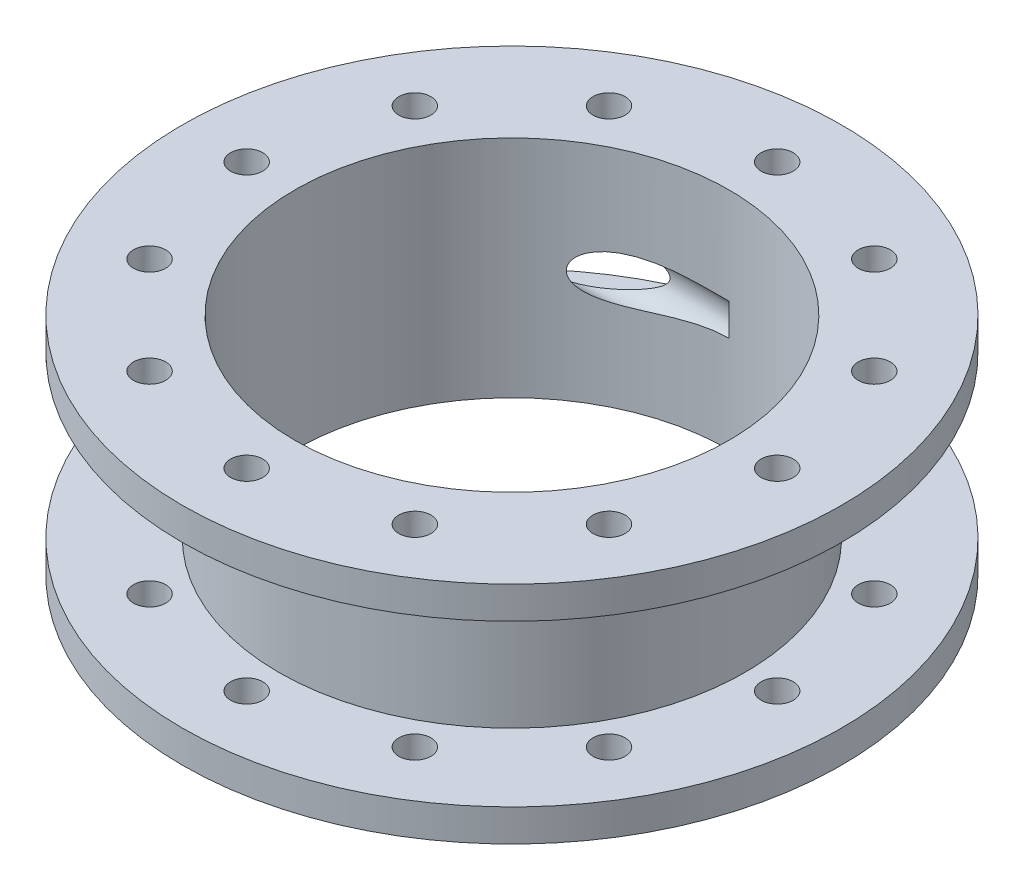
from build123d import *

# Parameters (mm, degrees)
SKETCH1_R            = 65.08749999999999
SKETCH1_R_2          = 3.1749999999997374
SKETCH1_R_3          = 3.174999999999826
SKETCH1_R_4          = 3.1749999999999874
SKETCH1_R_5          = 3.1749999999998075
SKETCH1_R_6          = 3.1749999999998435
SKETCH1_R_7          = 3.174999999999926
SKETCH1_R_8          = 3.1750000000000713
SKETCH1_R_9          = 3.1750000000002263
SKETCH1_R_10         = 3.1749999999999767
SKETCH1_R_11         = 3.175000000000085
SKETCH1_R_12         = 3.175000000000142
BOSS_EXTRUDE1_DEPTH  = 6.35
BOSS_EXTRUDE7_DEPTH  = 6.35
MOVE_FACE6_BY        = 6.35
MOVE_FACE6_2_BY      = 6.35
MOVE_FACE6_3_BY      = 6.35
BOSS_EXTRUDE8_START  = 44.449999999999996
BOSS_EXTRUDE8_DEPTH  = 44.449999999999996
BOSS_EXTRUDE10_START = 6.35
SKETCH1_13_R         = 65.08749999999999
SKETCH1_13_R_2       = 3.1749999999997374
SKETCH1_13_R_3       = 3.174999999999826
SKETCH1_13_R_4       = 3.1749999999999874
SKETCH1_13_R_5       = 3.1749999999998075
SKETCH1_13_R_6       = 3.1749999999998435
SKETCH1_13_R_7       = 3.174999999999926
SKETCH1_13_R_8       = 3.1750000000000713
SKETCH1_13_R_9       = 3.1750000000002263
SKETCH1_13_R_10      = 3.1749999999999767
SKETCH1_13_R_11      = 3.175000000000085
SKETCH1_13_R_12      = 3.175000000000142
BOSS_EXTRUDE10_DEPTH = 6.35
SKETCH2_R            = 4.49012806053458
CUT_EXTRUDE1_DEPTH   = 38.1


with BuildPart() as part:
    # Sketch1 → Boss-Extrude1 (new body)
    # profile 1 of 2: a face of its own
    with BuildSketch(Plane(origin=(0, 0, 0), x_dir=(1, 0, 0), z_dir=(0, 1, 0))):
        with Locations(Location((0, 0, 0), (0, 0, 270))):
            Circle(SKETCH1_R)
        with Locations(Location((-26.193749999999444, -45.36890584075757, 0), (0, 0, 270))):
            Circle(SKETCH1_R_2, mode=Mode.SUBTRACT)
        with Locations(Location((-45.36890584075695, -26.193750000000517, 0), (0, 0, 270))):
            Circle(SKETCH1_R_3, mode=Mode.SUBTRACT)
        with Locations(Location((-52.38749999999999, -5.8287e-13, 0), (0, 0, 270))):
            Circle(SKETCH1_R_4, mode=Mode.SUBTRACT)
        with Locations(Location((5.8437e-13, -52.38749999999999, 0), (0, 0, 270))):
            Circle(SKETCH1_R_5, mode=Mode.SUBTRACT)
        with Locations(Location((26.193750000000502, -45.368905840756966, 0), (0, 0, 270))):
            Circle(SKETCH1_R_6, mode=Mode.SUBTRACT)
        with Locations(Location((45.36890584075758, -26.193749999999447, 0), (0, 0, 270))):
            Circle(SKETCH1_R_7, mode=Mode.SUBTRACT)
        with Locations(Location((-45.36890584075756, 26.193749999999472, 0), (0, 0, 270))):
            Circle(SKETCH1_R_8, mode=Mode.SUBTRACT)
        with Locations(Location((-6.0368e-13, 52.38750000000001, 0), (0, 0, 270))):
            Circle(SKETCH1_R_9, mode=Mode.SUBTRACT)
        with BuildLine():
            Line((-24.244761862165653, 42.86249999999999), (-16.800520825261128, 42.8625))
            ThreePointArc((-16.80052082526106, 42.86249999999964), (25.94221876360081, 38.03225856916045), (46.0375, 0))
            ThreePointArc((46.0375, -1.128e-14), (-20.353392839950203, -41.29395604870844), (-28.040840750590878, 36.51250000000003))
            Line((-28.040840750590878, 36.51249999999999), (-38.10000000000001, 36.51249999999999))
            Line((-38.10000000000001, 36.51249999999999), (-38.10000000000001, 42.86249999999999))
            Line((-38.10000000000001, 42.86249999999999), (-28.142738137835213, 42.86249999999999))
            ThreePointArc((-28.142738137835213, 42.86249999999998), (-27.588846351937473, 48.2209807291169), (-23.01875000000034, 45.36890584075697))
            ThreePointArc((-23.01875000000034, 45.36890584075697), (-23.341675111640548, 43.973809488820095), (-24.24476186216568, 42.86250000000009))
        make_face(mode=Mode.SUBTRACT)
        with Locations(Location((52.38749999999997, 5.8711e-13, 0), (0, 0, 270))):
            Circle(SKETCH1_R_10, mode=Mode.SUBTRACT)
        with Locations(Location((45.36890584075695, 26.19375000000053, 0), (0, 0, 270))):
            Circle(SKETCH1_R_11, mode=Mode.SUBTRACT)
        with Locations(Location((26.19374999999944, 45.36890584075759, 0), (0, 0, 270))):
            Circle(SKETCH1_R_12, mode=Mode.SUBTRACT)
    # profile 2 of 2: a face of its own
    with BuildSketch(Plane(origin=(0, 0, 0), x_dir=(1, 0, 0), z_dir=(0, 1, 0))):
        with BuildLine():
            ThreePointArc((-28.040840750590878, 36.51250000000003), (-22.644371309313744, 40.08346110624591), (-16.80052082526106, 42.86249999999964))
            Line((-16.800520825261128, 42.8625), (-24.244761862165653, 42.86249999999999))
            ThreePointArc((-24.24476186216568, 42.86250000000009), (-26.19375000000043, 42.1939058407568), (-28.142738137835213, 42.86249999999998))
            Line((-28.142738137835213, 42.86249999999999), (-38.10000000000001, 42.86249999999999))
            Line((-38.10000000000001, 42.86249999999999), (-38.10000000000001, 36.51249999999999))
            Line((-38.10000000000001, 36.51249999999999), (-28.040840750590878, 36.51249999999999))
        make_face()
    extrude(amount=BOSS_EXTRUDE1_DEPTH)


with BuildPart() as part_1:
    # Move Face4: read off the stored shape, not the designer's step
    # Move Face4: moved
    add(part.part.moved(Location((0, 44.45, 0))))

    # Move Face6: a face moved outward by 6.35
    extrude(part_1.faces().sort_by_distance((-32.54375, 44.45, 52.07))[0], amount=MOVE_FACE6_BY, dir=(0, -1, 0))

    # Move Face6 2: a curved face moved outward by 6.35
    add(Solid.thicken(part_1.faces().sort_by_distance((0, 47.625, -65.0875))[0], -MOVE_FACE6_2_BY))

    # Move Face6 3: a face moved inward by 6.35
    extrude(part_1.faces().sort_by_distance((-32.54375, 50.8, 52.07))[0], amount=MOVE_FACE6_3_BY, dir=(0, -1, 0), mode=Mode.SUBTRACT)

    # Sketch1<11> → Boss-Extrude8 (add)
    with BuildSketch(Plane(origin=(0, 0, 0), x_dir=(1, 0, 0), z_dir=(0, 1, 0)).offset(BOSS_EXTRUDE8_START)):
        with BuildLine():
            ThreePointArc((-22.45064030267289, 36.512499999999996), (-11.66569490000489, 41.244459855233885), (2.62e-15, 42.8625))
            Line((0, 42.8625), (-16.800520825261128, 42.8625))
            ThreePointArc((-16.80052082526106, 42.86249999999964), (-22.644371309313744, 40.08346110624591), (-28.040840750590878, 36.51250000000003))
            Line((-28.040840750590878, 36.51249999999999), (-22.4506403026729, 36.51249999999999))
        make_face()
        with BuildLine():
            Line((-16.800520825261128, 42.8625), (0, 42.8625))
            ThreePointArc((2.62e-15, 42.8625), (30.308364408608394, 30.308364408608387), (42.8625, 0))
            ThreePointArc((42.8625, -1.05e-14), (-20.91534527896545, -37.41312922105898), (-22.45064030267289, 36.512499999999996))
            Line((-22.4506403026729, 36.51249999999999), (-28.040840750590878, 36.51249999999999))
            ThreePointArc((-28.040840750590878, 36.51250000000003), (-20.353392839950203, -41.29395604870844), (46.0375, -1.128e-14))
            ThreePointArc((46.0375, 0), (25.94221876360081, 38.03225856916045), (-16.80052082526106, 42.86249999999964))
        make_face()
    extrude(amount=-BOSS_EXTRUDE8_DEPTH)

    # Sketch1<13> → Boss-Extrude10 (add)
    # profile 1 of 2: a face of its own
    with BuildSketch(Plane(origin=(0, 0, 0), x_dir=(1, 0, 0), z_dir=(0, 1, 0)).offset(BOSS_EXTRUDE10_START)):
        with Locations(Location((0, 0, 0), (0, 0, 270))):
            Circle(SKETCH1_13_R)
        with Locations(Location((-26.193749999999444, -45.36890584075757, 0), (0, 0, 270))):
            Circle(SKETCH1_13_R_2, mode=Mode.SUBTRACT)
        with Locations(Location((-45.36890584075695, -26.193750000000517, 0), (0, 0, 270))):
            Circle(SKETCH1_13_R_3, mode=Mode.SUBTRACT)
        with Locations(Location((-52.38749999999999, -5.8287e-13, 0), (0, 0, 270))):
            Circle(SKETCH1_13_R_4, mode=Mode.SUBTRACT)
        with Locations(Location((5.8437e-13, -52.38749999999999, 0), (0, 0, 270))):
            Circle(SKETCH1_13_R_5, mode=Mode.SUBTRACT)
        with Locations(Location((26.193750000000502, -45.368905840756966, 0), (0, 0, 270))):
            Circle(SKETCH1_13_R_6, mode=Mode.SUBTRACT)
        with Locations(Location((45.36890584075758, -26.193749999999447, 0), (0, 0, 270))):
            Circle(SKETCH1_13_R_7, mode=Mode.SUBTRACT)
        with Locations(Location((-45.36890584075756, 26.193749999999472, 0), (0, 0, 270))):
            Circle(SKETCH1_13_R_8, mode=Mode.SUBTRACT)
        with Locations(Location((-6.0368e-13, 52.38750000000001, 0), (0, 0, 270))):
            Circle(SKETCH1_13_R_9, mode=Mode.SUBTRACT)
        with BuildLine():
            Line((-24.244761862165653, 42.86249999999999), (-16.800520825261128, 42.8625))
            ThreePointArc((-16.80052082526106, 42.86249999999964), (25.94221876360081, 38.03225856916045), (46.0375, 0))
            ThreePointArc((46.0375, -1.128e-14), (-20.353392839950203, -41.29395604870844), (-28.040840750590878, 36.51250000000003))
            Line((-28.040840750590878, 36.51249999999999), (-38.10000000000001, 36.51249999999999))
            Line((-38.10000000000001, 36.51249999999999), (-38.10000000000001, 42.86249999999999))
            Line((-38.10000000000001, 42.86249999999999), (-28.142738137835213, 42.86249999999999))
            ThreePointArc((-28.142738137835213, 42.86249999999998), (-27.588846351937473, 48.2209807291169), (-23.01875000000034, 45.36890584075697))
            ThreePointArc((-23.01875000000034, 45.36890584075697), (-23.341675111640548, 43.973809488820095), (-24.24476186216568, 42.86250000000009))
        make_face(mode=Mode.SUBTRACT)
        with Locations(Location((52.38749999999997, 5.8711e-13, 0), (0, 0, 270))):
            Circle(SKETCH1_13_R_10, mode=Mode.SUBTRACT)
        with Locations(Location((45.36890584075695, 26.19375000000053, 0), (0, 0, 270))):
            Circle(SKETCH1_13_R_11, mode=Mode.SUBTRACT)
        with Locations(Location((26.19374999999944, 45.36890584075759, 0), (0, 0, 270))):
            Circle(SKETCH1_13_R_12, mode=Mode.SUBTRACT)
    # profile 2 of 2: a face of its own
    with BuildSketch(Plane(origin=(0, 0, 0), x_dir=(1, 0, 0), z_dir=(0, 1, 0)).offset(BOSS_EXTRUDE10_START)):
        with BuildLine():
            ThreePointArc((-28.040840750590878, 36.51250000000003), (-22.644371309313744, 40.08346110624591), (-16.80052082526106, 42.86249999999964))
            Line((-16.800520825261128, 42.8625), (-24.244761862165653, 42.86249999999999))
            ThreePointArc((-24.24476186216568, 42.86250000000009), (-26.19375000000043, 42.1939058407568), (-28.142738137835213, 42.86249999999998))
            Line((-28.142738137835213, 42.86249999999999), (-38.10000000000001, 42.86249999999999))
            Line((-38.10000000000001, 42.86249999999999), (-38.10000000000001, 36.51249999999999))
            Line((-38.10000000000001, 36.51249999999999), (-28.040840750590878, 36.51249999999999))
        make_face()
    extrude(amount=-BOSS_EXTRUDE10_DEPTH)


with BuildPart() as body_2:
    # Sketch1<9> → Boss-Extrude7 (new body)
    with BuildSketch(Plane(origin=(0, 0, 0), x_dir=(1, 0, 0), z_dir=(0, 1, 0))):
        Polygon((0, 36.51249999999999), (0, 42.8625), (-38.10000000000001, 42.86249999999999), (-38.10000000000001, 36.51249999999999), align=None)
    extrude(amount=BOSS_EXTRUDE7_DEPTH)


with BuildPart() as body_2_1:
    # Move Face5: read off the stored shape, not the designer's step
    # Move Face5: moved
    add(body_2.part.moved(Location((0, 19.05, 0))))


with BuildPart() as cut_extrude1_tool:
    # Sketch2 → Cut-Extrude1 (new body)
    with BuildSketch(Plane.ZY.offset(38.10000000000001)):
        with Locations((-39.68749999999999, 22.225)):
            Circle(SKETCH2_R)
    extrude(amount=-CUT_EXTRUDE1_DEPTH)


with BuildPart() as part_2:
    add(part_1.part)

    # Cut-Extrude1: cut by cut_extrude1_tool
    add(cut_extrude1_tool.part, mode=Mode.SUBTRACT)


with BuildPart() as body_2_2:
    add(body_2_1.part)

    # Cut-Extrude1: cut by cut_extrude1_tool
    add(cut_extrude1_tool.part, mode=Mode.SUBTRACT)


solid = part_2.part
